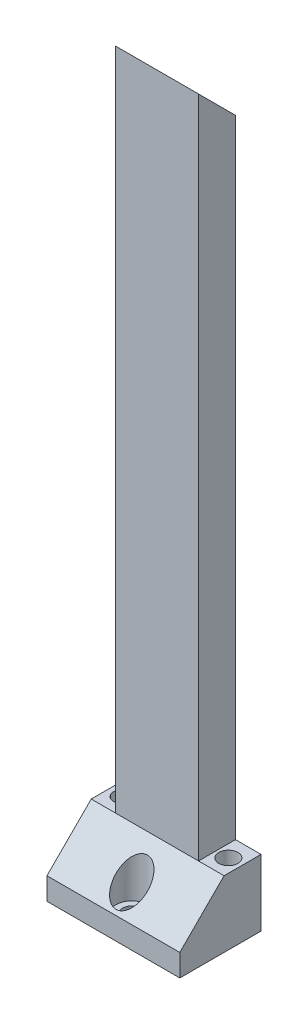
from build123d import *

# Parameters (mm, degrees)
BOSS_EXTRUDE1_DEPTH = 15
CHAMFER1_SIZE       = 10
SKETCH2_R           = 3.544680495
CUT_EXTRUDE1_DEPTH  = 12
SKETCH3_W           = 18.759195859
SKETCH3_H           = 8.35
BOSS_EXTRUDE2_DEPTH = 150
CUT_EXTRUDE2_DEPTH  = 150
SKETCH5_W           = 12.715839202
SKETCH5_H           = 3.591790086
CUT_EXTRUDE3_DEPTH  = 4


with BuildPart() as part:
    # Sketch1 → Boss-Extrude1 (new body)
    with BuildSketch(Plane(origin=(0, 0, 0), x_dir=(1, 0, 0), z_dir=(0, 1, 0))):
        with BuildLine():
            Line((13, 8.926911476), (-2, 8.926911476))
            Line((-2, 8.926911476), (-2, 4.542283032))
            Line((-2, 4.542283032), (7.841609066, 4.542283032))
            ThreePointArc((7.841609066, 4.542283032), (10, 6.700673966), (12.158390934, 4.542283032))
            Line((12.158390934, 4.542283032), (13, 4.542283032))
            Line((13, 4.542283032), (13, 8.926911476))
        make_face()
        with BuildLine():
            Line((-2, 4.542283032), (-2, 8.926911476))
            Line((-2, 8.926911476), (-17, 8.926911476))
            Line((-17, 8.926911476), (-17, 4.542283032))
            Line((-17, 4.542283032), (-15.919451213, 4.542283032))
            ThreePointArc((-15.919451213, 4.542283032), (-14, 6.461734245), (-12.080548787, 4.542283032))
            Line((-12.080548787, 4.542283032), (-2, 4.542283032))
        make_face()
        with BuildLine():
            Line((-2, -3.130873366), (-2, 4.542283032))
            Line((-2, 4.542283032), (-12.080548787, 4.542283032))
            ThreePointArc((-12.080548787, 4.542283032), (-14, 2.622831819), (-15.919451213, 4.542283032))
            Line((-15.919451213, 4.542283032), (-17, 4.542283032))
            Line((-17, 4.542283032), (-17, -9.423088524))
            Line((-17, -9.423088524), (-2, -9.423088524))
            Line((-2, -9.423088524), (-2, -7.40597744))
            ThreePointArc((-2, -7.40597744), (-4.137552037, -5.268425403), (-2, -3.130873366))
        make_face()
        with BuildLine():
            Line((7.841609066, 4.542283032), (-2, 4.542283032))
            Line((-2, 4.542283032), (-2, -3.130873366))
            ThreePointArc((-2, -3.130873366), (-0.488522459, -3.756947863), (0.137552037, -5.268425403))
            ThreePointArc((0.137552037, -5.268425403), (-0.488522459, -6.779902944), (-2, -7.40597744))
            Line((-2, -7.40597744), (-2, -9.423088524))
            Line((-2, -9.423088524), (13, -9.423088524))
            Line((13, -9.423088524), (13, 4.542283032))
            Line((13, 4.542283032), (12.158390934, 4.542283032))
            ThreePointArc((12.158390934, 4.542283032), (10, 2.383892098), (7.841609066, 4.542283032))
        make_face()
    extrude(amount=BOSS_EXTRUDE1_DEPTH)

    # Chamfer1
    # the kernel refuses this chamfer: 10 mm, written as the material it takes off along each edge
    with BuildSketch(Plane(origin=(-42.71682988, 15, 9.423088524), x_dir=(0, -0.9996219169112968, 0.027495876610586317), z_dir=(1, 0, 0))) as chamfer1_piece_1:
        Polygon((CHAMFER1_SIZE * 0.999621916911, CHAMFER1_SIZE * 0.0274958766106), (-CHAMFER1_SIZE * 0.0274958766106, CHAMFER1_SIZE * 0.999621916911), (0, 0), align=None)
    extrude(amount=81.433659759, mode=Mode.SUBTRACT)

    # Sketch2 → Cut-Extrude1 (cut)
    with BuildSketch(Plane(origin=(0, 15, 0), x_dir=(1, 0, 0), z_dir=(0, 1, 0))):
        with Locations(Location((-2, -5.268425403, 0), (0, 0, 270))):
            Circle(SKETCH2_R)
    extrude(amount=-CUT_EXTRUDE1_DEPTH, mode=Mode.SUBTRACT)

    # Sketch3 → Boss-Extrude2 (add)
    with BuildSketch(Plane(origin=(0, 15, 0), x_dir=(1, 0, 0), z_dir=(0, 1, 0))):
        with Locations((-2.146940407, 4.751911476)):
            Rectangle(SKETCH3_W, SKETCH3_H)
    extrude(amount=BOSS_EXTRUDE2_DEPTH)

    # Sketch4 → Cut-Extrude2 (cut)
    with BuildSketch(Plane(origin=(7.232657523, 0, 0), x_dir=(0, 0, -1), z_dir=(1, 0, 0))):
        Polygon((0.576911476, 165), (8.926911476, 156.65), (8.926911476, 165), align=None)
    extrude(amount=-CUT_EXTRUDE2_DEPTH, mode=Mode.SUBTRACT)

    # Sketch5 → Cut-Extrude3 (cut)
    with BuildSketch(Plane(origin=(0, 82.788455738, -82.788455738), x_dir=(1, 0, 0), z_dir=(0, 0.707106781186556, -0.707106781186539))):
        with Locations((-2.621419411, -110.225300743)):
            Rectangle(SKETCH5_W, SKETCH5_H)
    extrude(amount=-CUT_EXTRUDE3_DEPTH, mode=Mode.SUBTRACT)


solid = part.part
